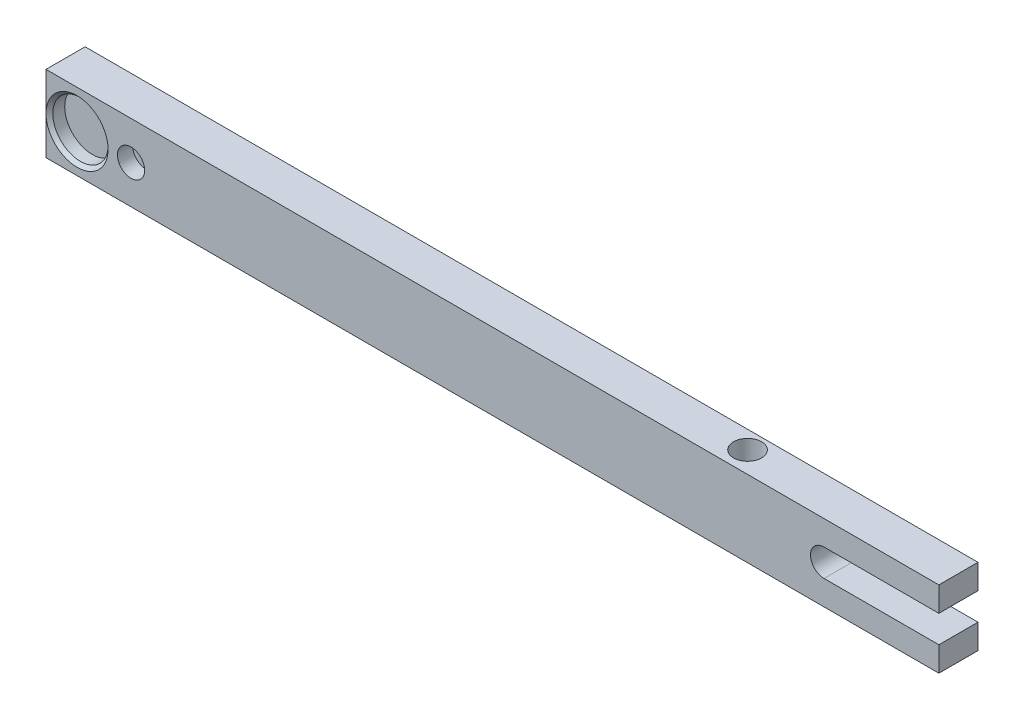
from build123d import *

# Parameters (mm, degrees)
SKETCH1_W           = 105
SKETCH1_H           = 9
BOSS_EXTRUDE1_DEPTH = 5
CUT_EXTRUDE1_DEPTH  = 5
SKETCH8_W           = 8
SKETCH8_H           = 3.2
CUT_EXTRUDE4_DEPTH  = 10
SKETCH7_R           = 3.25
SKETCH7_R_2         = 1.6
CUT_EXTRUDE2_DEPTH  = 1.8
CHAMFER1_SIZE       = 0.4
CHAMFER2_SIZE       = 0.4
SKETCH2_R           = 1.65
CUT_EXTRUDE3_DEPTH  = 10
SKETCH10_R          = 1.5
CUT_EXTRUDE5_DEPTH  = 4


with BuildPart() as part:
    # Sketch1 → Boss-Extrude1 (new body)
    with BuildSketch(Plane.XY):
        Rectangle(SKETCH1_W, SKETCH1_H)
    extrude(amount=BOSS_EXTRUDE1_DEPTH)

    # Sketch4 → Cut-Extrude1 (cut)
    with BuildSketch(Plane.XY.offset(5)):
        with BuildLine():
            Line((39, 1.6), (45, 1.6))
            ThreePointArc((45, 1.6), (46.6, 0), (45, -1.6))
            Line((45, -1.6), (39, -1.6))
            ThreePointArc((39, -1.6), (37.4, 0), (39, 1.6))
        make_face()
    extrude(amount=-CUT_EXTRUDE1_DEPTH, mode=Mode.SUBTRACT)

    # Sketch8 → Cut-Extrude4 (cut)
    with BuildSketch(Plane.XY.offset(5)):
        with Locations((48.5, 0)):
            Rectangle(SKETCH8_W, SKETCH8_H)
    extrude(amount=-CUT_EXTRUDE4_DEPTH, mode=Mode.SUBTRACT)

    # Sketch7 → Cut-Extrude2 (cut)
    with BuildSketch(Plane(origin=(0, 0, 5), x_dir=(-1, 0, 0), z_dir=(0, 0, -1))):
        with Locations((48.85, 0)):
            Circle(SKETCH7_R)
        with Locations((42.5, 0)):
            Circle(SKETCH7_R_2)
    extrude(amount=CUT_EXTRUDE2_DEPTH, mode=Mode.SUBTRACT)

    # Chamfer1
    chamfer1_edges = [part.edges().sort_by_distance(p)[0] for p in [
        (-45.6, 0, 5),
    ]]
    chamfer(chamfer1_edges, length=CHAMFER1_SIZE - 0.0001)  # a hair under: the kernel refuses the full size

    # Chamfer2
    chamfer2_edges = [part.edges().sort_by_distance(p)[0] for p in [
        (37.4, 0, 0),
        (45.75, 1.6, 0),
        (45.75, -1.6, 0),
        (52.5, 3.05, 0),
        (0, 4.5, 0),
        (52.5, -3.05, 0),
        (0, -4.5, 0),
        (-52.5, 0, 0),
    ]]
    chamfer(chamfer2_edges, length=CHAMFER2_SIZE)

    # Sketch2 → Cut-Extrude3 (cut)
    with BuildSketch(Plane(origin=(0, 4.5, 0), x_dir=(1, 0, 0), z_dir=(0, 1, 0))):
        with Locations(Location((27.5, -2.5, 0), (0, 0, 180))):
            Circle(SKETCH2_R)
    extrude(amount=-CUT_EXTRUDE3_DEPTH, mode=Mode.SUBTRACT)

    # Sketch10 → Cut-Extrude5 (cut, symmetric)
    with BuildSketch(Plane.XY):
        with Locations((-2.5, 0)):
            Circle(SKETCH10_R)
    extrude(amount=CUT_EXTRUDE5_DEPTH, both=True, mode=Mode.SUBTRACT)


solid = part.part
